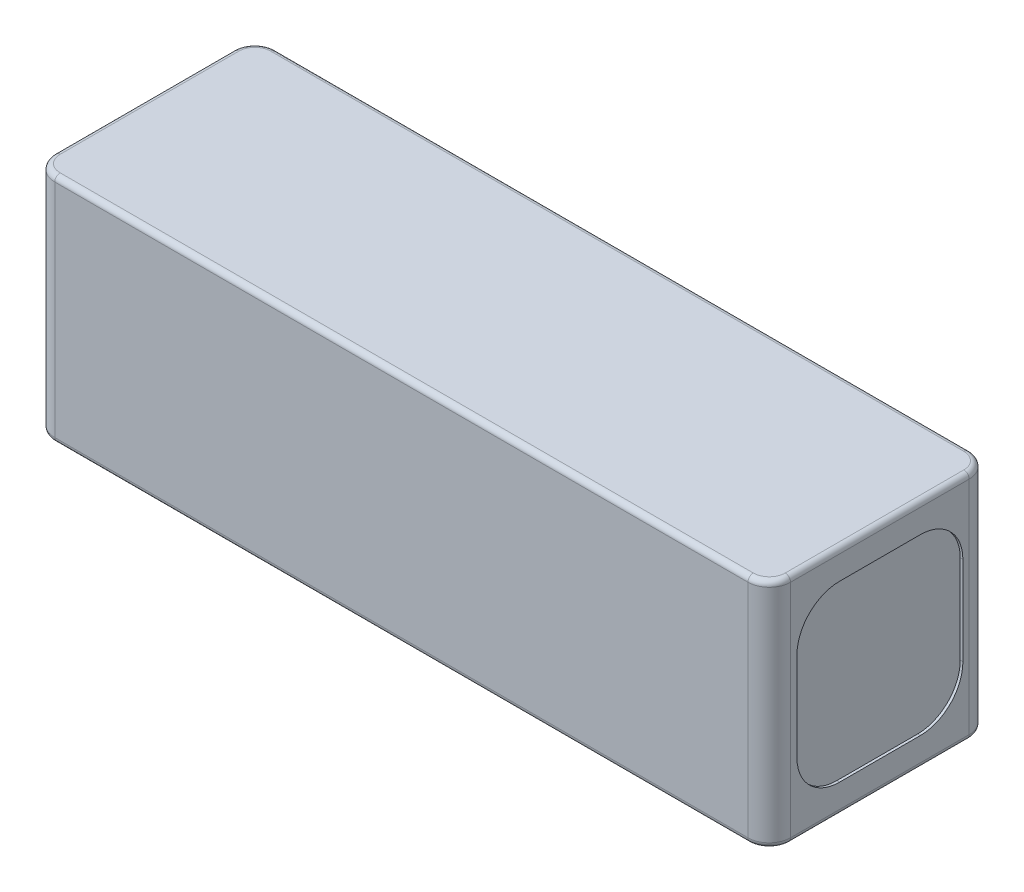
from build123d import *

# Parameters (mm, degrees)
SKETCH1_W           = 138
SKETCH1_H           = 43.5
BOSS_EXTRUDE1_DEPTH = 41.5
CUT_EXTRUDE1_DEPTH  = 0.5
CUT_EXTRUDE2_START  = -0.5
CUT_EXTRUDE2_DEPTH  = 0.5
FILLET1_R           = 4
FILLET2_R           = 1


with BuildPart() as part:
    # Sketch1 → Boss-Extrude1 (new body)
    with BuildSketch(Plane(origin=(0, 0, -15), x_dir=(-1, 0, 0), z_dir=(0, 0, -1))):
        with Locations((0, -0.25)):
            Rectangle(SKETCH1_W, SKETCH1_H)
    extrude(amount=-BOSS_EXTRUDE1_DEPTH)

    # Sketch2 → Cut-Extrude1 (cut)
    with BuildSketch(Plane(origin=(69, 0, 0), x_dir=(0, 0, -1), z_dir=(1, 0, 0))):
        with BuildLine():
            Line((-21.3125, 8.0625), (-21.3125, -8.5625))
            ThreePointArc((-21.3125, -8.5625), (-18.969354249, -14.219354249), (-13.3125, -16.5625))
            Line((-13.3125, -16.5625), (1.8125, -16.5625))
            ThreePointArc((1.8125, -16.5625), (7.469354249, -14.219354249), (9.8125, -8.5625))
            Line((9.8125, -8.5625), (9.8125, 8.0625))
            ThreePointArc((9.8125, 8.0625), (7.469354249, 13.719354249), (1.8125, 16.0625))
            Line((1.8125, 16.0625), (-13.3125, 16.0625))
            ThreePointArc((-13.3125, 16.0625), (-18.969354249, 13.719354249), (-21.3125, 8.0625))
        make_face()
    extrude(amount=-CUT_EXTRUDE1_DEPTH, mode=Mode.SUBTRACT)

    # Sketch3 → Cut-Extrude2 (cut)
    with BuildSketch(Plane.ZY.offset(69).offset(CUT_EXTRUDE2_START)):
        with BuildLine():
            Line((13.3125, 16.0625), (-1.8125, 16.0625))
            ThreePointArc((-1.8125, 16.0625), (-7.469354249, 13.719354249), (-9.8125, 8.0625))
            Line((-9.8125, 8.0625), (-9.8125, -8.5625))
            ThreePointArc((-9.8125, -8.5625), (-7.469354249, -14.219354249), (-1.8125, -16.5625))
            Line((-1.8125, -16.5625), (13.3125, -16.5625))
            ThreePointArc((13.3125, -16.5625), (18.969354249, -14.219354249), (21.3125, -8.5625))
            Line((21.3125, -8.5625), (21.3125, 8.0625))
            ThreePointArc((21.3125, 8.0625), (18.969354249, 13.719354249), (13.3125, 16.0625))
        make_face()
    extrude(amount=CUT_EXTRUDE2_DEPTH, mode=Mode.SUBTRACT)

    # Fillet1
    fillet1_edges = [part.edges().sort_by_distance(p)[0] for p in [
        (-69, -0.25, -15),
        (-69, -0.25, 26.5),
        (69, -0.25, -15),
        (69, -0.25, 26.5),
    ]]
    fillet(fillet1_edges, radius=FILLET1_R)

    # Fillet2
    fillet2_edges = [part.edges().sort_by_distance(p)[0] for p in [
        (67.828427125, 21.5, -13.828427125),
        (69, 21.5, 5.75),
        (0, 21.5, -15),
        (67.828427125, 21.5, 25.328427125),
        (-67.828427125, 21.5, -13.828427125),
        (0, 21.5, 26.5),
        (-69, 21.5, 5.75),
        (-67.828427125, 21.5, 25.328427125),
        (-69, -22, 5.75),
        (-67.828427125, -22, -13.828427125),
        (-67.828427125, -22, 25.328427125),
        (0, -22, -15),
        (0, -22, 26.5),
        (67.828427125, -22, -13.828427125),
        (67.828427125, -22, 25.328427125),
        (69, -22, 5.75),
    ]]
    fillet(fillet2_edges, radius=FILLET2_R)


solid = part.part
